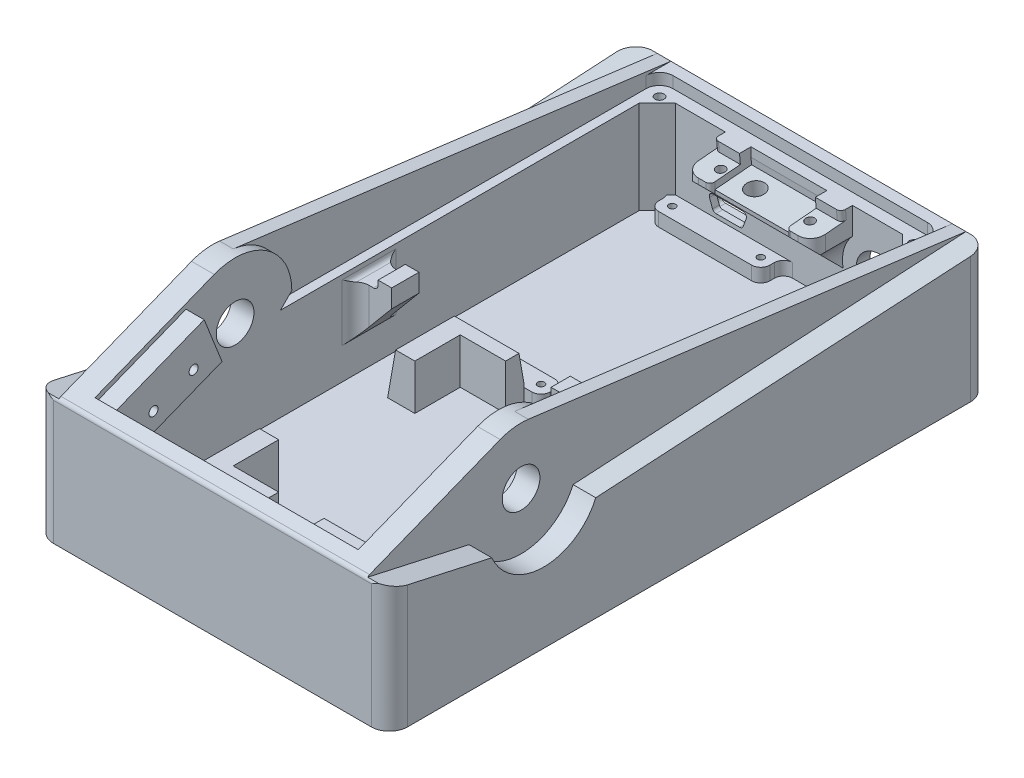
from build123d import *

# Parameters (mm, degrees)
SKETCH1_W            = 78
SKETCH1_H            = 132
BOSS_EXTRUDE1_DEPTH  = 45
SKETCH2_R            = 4.15
CUT_EXTRUDE1_DEPTH   = 65
SKETCH3_W            = 58
SKETCH3_H            = 122
CUT_EXTRUDE2_DEPTH   = 130
CUT_EXTRUDE4_DEPTH   = 5
FILLET1_R            = 4
CUT_EXTRUDE24_DEPTH  = 31
SKETCH37_W           = 62
SKETCH37_H           = 85.5
CUT_EXTRUDE25_DEPTH  = 2.5
CHAMFER6_SIZE        = 2.5
CHAMFER7_SIZE        = 2.5
SKETCH12_W           = 24.5
SKETCH12_H           = 5
SKETCH12_R           = 0.75
BOSS_EXTRUDE2_DEPTH  = 3
FILLET17_R           = 2
CUT_EXTRUDE13_DEPTH  = 3.5
BOSS_EXTRUDE3_DEPTH  = 4
BOSS_EXTRUDE11_DEPTH = 10
SKETCH21_R           = 1
CUT_EXTRUDE16_DEPTH  = 5
BOSS_EXTRUDE9_DEPTH  = 14
BOSS_EXTRUDE10_REACH = 108.054
SKETCH29_W           = 5.65
SKETCH29_H           = 2.524311486
SKETCH30_R           = 1
CUT_EXTRUDE19_DEPTH  = 8
CUT_EXTRUDE14_DEPTH  = 10
SKETCH13_R           = 7.5
CUT_EXTRUDE11_DEPTH  = 2
SKETCH14_R           = 5.2
CUT_EXTRUDE12_DEPTH  = 12
CHAMFER1_SIZE        = 1
FILLET7_R            = 3
FILLET8_R            = 1
SKETCH32_W           = 16.7
SKETCH32_H           = 9.108931259
CUT_EXTRUDE20_DEPTH  = 1.5
SKETCH33_W           = 16.7
SKETCH33_H           = 1
CUT_EXTRUDE21_DEPTH  = 3
FILLET9_R            = 1
CHAMFER2_SIZE        = 2
CHAMFER2_SIZE2       = 2.832352561
CHAMFER3_SIZE        = 4.5
CHAMFER3_SIZE2       = 3.77594834
SKETCH39_R           = 2
CUT_EXTRUDE27_DEPTH  = 9.5
FILLET10_R           = 3
SKETCH40_R           = 8.2
CUT_EXTRUDE28_DEPTH  = 9.5
CHAMFER4_SIZE        = 4
SKETCH41_R           = 1
CUT_EXTRUDE29_DEPTH  = 8
FILLET13_R           = 1
FILLET14_R           = 2
SKETCH53_R           = 3.5
CUT_EXTRUDE34_DEPTH  = 16
CHAMFER12_SIZE       = 2
CHAMFER12_SIZE_2     = 11.342563639
BOSS_EXTRUDE12_DEPTH = 1.5
MIRROR4_START        = -32.5
MIRROR4_DEPTH        = 6
FILLET22_R           = 3
FILLET23_R           = 1
CHAMFER13_SIZE       = 6
CHAMFER13_SIZE2      = 1.057961884


with BuildPart() as part:
    # Sketch1 → Boss-Extrude1 (new body)
    with BuildSketch(Plane(origin=(0, 0, 0), x_dir=(1, 0, 0), z_dir=(0, 1, 0))):
        with Locations((0, 32)):
            Rectangle(SKETCH1_W, SKETCH1_H)
    extrude(amount=BOSS_EXTRUDE1_DEPTH)

    # Sketch2 → Cut-Extrude1 (cut, symmetric)
    with BuildSketch(Plane(origin=(0, 0, 0), x_dir=(0, 0, -1), z_dir=(1, 0, 0))):
        with Locations((0, 28)):
            Circle(SKETCH2_R)
        with BuildLine():
            Line((-4.595588235, 39.624567466), (-34, 28))
            Line((-34, 28), (-34, 45))
            Line((-34, 45), (98, 45))
            Line((98, 45), (98, 28))
            Line((98, 28), (1.594387755, 40.397900132))
            ThreePointArc((1.594387755, 40.397900132), (-1.549616705, 40.403575616), (-4.595588235, 39.624567466))
        make_face()
    extrude(amount=CUT_EXTRUDE1_DEPTH, both=True, mode=Mode.SUBTRACT)

    # Sketch3 → Cut-Extrude2 (cut)
    with BuildSketch(Plane(origin=(0, 5, 0), x_dir=(1, 0, 0), z_dir=(0, 1, 0))):
        with Locations((0, 32)):
            Rectangle(SKETCH3_W, SKETCH3_H)
    extrude(amount=CUT_EXTRUDE2_DEPTH, mode=Mode.SUBTRACT)

    # Sketch4 → Cut-Extrude4 (cut)
    with BuildSketch(Plane(origin=(39, 0, 0), x_dir=(0, 0, -1), z_dir=(1, 0, 0))):
        with BuildLine():
            Line((-34, 28), (-11.456439237, 23))
            ThreePointArc((-11.456439237, 23), (0, 15.5), (11.456439237, 23))
            Line((11.456439237, 23), (98, 28))
            Line((98, 28), (-1.600234273, 40.808733111))
            Line((-1.600234273, 40.808733111), (-34, 28))
        make_face()
    cut_extrude4 = extrude(amount=-CUT_EXTRUDE4_DEPTH, mode=Mode.SUBTRACT)

    # Mirror2: Cut-Extrude4 across plane
    add(cut_extrude4.mirror(Plane(origin=(0, 0, 0), x_dir=(0, 0, 1), z_dir=(1, 0, 0))), mode=Mode.SUBTRACT)

    # Fillet1
    fillet1_edges = [part.edges().sort_by_distance(p)[0] for p in [
        (-39, 14, -98),
        (39, 14, -98),
        (39, 14, 34),
        (-39, 14, 34),
    ]]
    fillet(fillet1_edges, radius=FILLET1_R)

    # Sketch34 → Cut-Extrude24 (cut, symmetric)
    with BuildSketch(Plane(origin=(0, 0, 0), x_dir=(0, 0, -1), z_dir=(1, 0, 0))):
        with BuildLine():
            Line((1.594387755, 40.397900132), (98, 28))
            Line((98, 28), (12.5, 28))
            ThreePointArc((12.5, 28), (9.385623233, 36.255911611), (1.594387755, 40.397900132))
        make_face()
    extrude(amount=CUT_EXTRUDE24_DEPTH, both=True, mode=Mode.SUBTRACT)

    # Sketch37 → Cut-Extrude25 (cut)
    with BuildSketch(Plane(origin=(0, 28, 0), x_dir=(1, 0, 0), z_dir=(0, 1, 0))):
        with Locations((0, 52.75)):
            Rectangle(SKETCH37_W, SKETCH37_H)
    extrude(amount=-CUT_EXTRUDE25_DEPTH, mode=Mode.SUBTRACT)

    # Chamfer6
    chamfer6_edges = [part.edges().sort_by_distance(p)[0] for p in [
        (-30, 28, -10),
    ]]
    chamfer(chamfer6_edges, length=CHAMFER6_SIZE - 0.0001)  # a hair under: the kernel refuses the full size

    # Chamfer7
    chamfer7_edges = [part.edges().sort_by_distance(p)[0] for p in [
        (30, 28, -10),
    ]]
    chamfer(chamfer7_edges, length=CHAMFER7_SIZE - 0.0001)  # a hair under: the kernel refuses the full size

    # Sketch12 → Boss-Extrude2 (add)
    # profile 1 of 2: a face of its own
    with BuildSketch(Plane(origin=(0, 5, 0), x_dir=(1, 0, 0), z_dir=(0, 1, 0))):
        with Locations((-13.45, 90.5)):
            Rectangle(SKETCH12_W, SKETCH12_H)
        with Locations(Location((-3.7, 90.5, 0), (0, 0, 90))):
            Circle(SKETCH12_R, mode=Mode.SUBTRACT)
        with Locations(Location((-23.2, 90.5, 0), (0, 0, 90))):
            Circle(SKETCH12_R, mode=Mode.SUBTRACT)
    # profile 2 of 2: a face of its own
    with BuildSketch(Plane(origin=(0, 5, 0), x_dir=(1, 0, 0), z_dir=(0, 1, 0))):
        with Locations((-13.45, 42.1)):
            Rectangle(SKETCH12_W, SKETCH12_H)
        with Locations(Location((-3.7, 42.1, 0), (0, 0, 90))):
            Circle(SKETCH12_R, mode=Mode.SUBTRACT)
        with Locations(Location((-23.2, 42.1, 0), (0, 0, 90))):
            Circle(SKETCH12_R, mode=Mode.SUBTRACT)
    extrude(amount=BOSS_EXTRUDE2_DEPTH)

    # Fillet17
    fillet17_edges = [part.edges().sort_by_distance(p)[0] for p in [
        (-25.7, 6.5, -93),
        (-25.7, 6.5, -88),
        (-1.2, 6.5, -88),
        (-1.2, 6.5, -93),
        (-25.7, 6.5, -44.6),
        (-25.7, 6.5, -39.6),
        (-1.2, 6.5, -39.6),
        (-1.2, 6.5, -44.6),
    ]]
    fillet(fillet17_edges, radius=FILLET17_R)

    # Sketch15 → Cut-Extrude13 (cut)
    with BuildSketch(Plane(origin=(0, 0, -98), x_dir=(-1, 0, 0), z_dir=(0, 0, -1))):
        with BuildLine():
            Line((7.95, 13.93852886), (18.95, 13.93852886))
            ThreePointArc((18.95, 13.93852886), (19.657106781, 13.645635641), (19.95, 12.93852886))
            Line((19.95, 12.93852886), (19.95, 7.93852886))
            ThreePointArc((19.95, 7.93852886), (19.657106781, 7.231422078), (18.95, 6.93852886))
            Line((18.95, 6.93852886), (7.95, 6.93852886))
            ThreePointArc((7.95, 6.93852886), (7.242893219, 7.231422078), (6.95, 7.93852886))
            Line((6.95, 7.93852886), (6.95, 12.93852886))
            ThreePointArc((6.95, 12.93852886), (7.242893219, 13.645635641), (7.95, 13.93852886))
        make_face()
    extrude(amount=-CUT_EXTRUDE13_DEPTH, mode=Mode.SUBTRACT)

    # Sketch18 → Boss-Extrude3 (add)
    with BuildSketch(Plane(origin=(-29, 0, 0), x_dir=(0, 0, -1), z_dir=(1, 0, 0))):
        Polygon((-10.806851224, 36.093734406), (-29, 28.90136181), (-29, 17.395557367), (-6.873027694, 26.143104655), align=None)
    extrude(amount=BOSS_EXTRUDE3_DEPTH)

    # Sketch57 → Boss-Extrude11 (add)
    with BuildSketch(Plane(origin=(0, 5, 0), x_dir=(1, 0, 0), z_dir=(0, 1, 0))):
        Polygon((5, 35.6), (5, 39.6), (19, 39.6), (19, 25.6), (15, 25.6), (15, 35.6), align=None)
        Polygon((-5, 35.6), (-5, 39.6), (-19, 39.6), (-19, 25.6), (-15, 25.6), (-15, 35.6), align=None)
        Polygon((15, -4.4), (15, -14.4), (5, -14.4), (5, -18.4), (19, -18.4), (19, -4.4), align=None)
        Polygon((-5, -14.4), (-5, -18.4), (-19, -18.4), (-19, -4.4), (-15, -4.4), (-15, -14.4), align=None)
    extrude(amount=BOSS_EXTRUDE11_DEPTH)

    # Sketch21 → Cut-Extrude16 (cut)
    with BuildSketch(Plane(origin=(-25, 0, 0), x_dir=(0, 0, -1), z_dir=(1, 0, 0))):
        with Locations((-13.134022501, 27.700327836)):
            Circle(SKETCH21_R)
        with Locations((-21.968693775, 24.207680777)):
            Circle(SKETCH21_R)
    extrude(amount=-CUT_EXTRUDE16_DEPTH, mode=Mode.SUBTRACT)

    # Sketch28 → Boss-Extrude9 (add, symmetric)
    with BuildSketch(Plane(origin=(0, 0, 0), x_dir=(0, 0, -1), z_dir=(1, 0, 0))):
        Polygon((84.034247717, 21.465752283), (93, 12.5), (93, 23.5), (84.034247717, 22.715598315), align=None)
    extrude(amount=BOSS_EXTRUDE9_DEPTH, both=True)

    # Boss-Extrude10: up to this plane
    boss_extrude10_end = Plane(origin=(0, 25.5, 0), z_dir=(0, -1, 0))
    # Sketch29 → Boss-Extrude10 (add, up to the surface)
    with BuildSketch(Plane(origin=(0, 15.588817922, -2.574775068), x_dir=(1, 0, 0), z_dir=(0, 0.9961946980917453, 0.08715574274766208)), mode=Mode.PRIVATE) as boss_extrude10_sk1:
        with Locations((-11.175, 89.682790344)):
            Rectangle(SKETCH29_W, SKETCH29_H)
    boss_extrude10_tool1 = split(extrude(boss_extrude10_sk1.sketch, amount=BOSS_EXTRUDE10_REACH, mode=Mode.PRIVATE), bisect_by=boss_extrude10_end, keep=Keep.BOTH, mode=Mode.PRIVATE)
    add(boss_extrude10_tool1.solids().sort_by_distance((-11.175, 23.405188, -91.916295))[0])
    # Sketch29 → Boss-Extrude10 (add, up to the surface)
    with BuildSketch(Plane(origin=(0, 15.588817922, -2.574775068), x_dir=(1, 0, 0), z_dir=(0, 0.9961946980917453, 0.08715574274766208)), mode=Mode.PRIVATE) as boss_extrude10_sk2:
        with Locations((11.175, 89.682790344)):
            Rectangle(SKETCH29_W, SKETCH29_H)
    boss_extrude10_tool2 = split(extrude(boss_extrude10_sk2.sketch, amount=BOSS_EXTRUDE10_REACH, mode=Mode.PRIVATE), bisect_by=boss_extrude10_end, keep=Keep.BOTH, mode=Mode.PRIVATE)
    add(boss_extrude10_tool2.solids().sort_by_distance((11.175, 23.405188, -91.916295))[0])

    # Sketch30 → Cut-Extrude19 (cut)
    with BuildSketch(Plane(origin=(0, 15.246850836, 1.333926603), x_dir=(1, 0, 0), z_dir=(0, 0.9961946980917453, 0.08715574274766208))):
        with Locations(Location((9.85, 89.494266877, 0), (0, 0, 270))):
            Circle(SKETCH30_R)
        with Locations(Location((-9.85, 89.494266877, 0), (0, 0, 270))):
            Circle(SKETCH30_R)
    extrude(amount=-CUT_EXTRUDE19_DEPTH, mode=Mode.SUBTRACT)

    # Sketch16 → Cut-Extrude14 (cut)
    with BuildSketch(Plane(origin=(0, 0, -94.5), x_dir=(-1, 0, 0), z_dir=(0, 0, -1))):
        with BuildLine():
            Line((16.825589898, 9.426383885), (17.487680093, 11.245461748))
            ThreePointArc((17.487680093, 11.245461748), (17.391247632, 11.977939011), (16.735925997, 12.319077862))
            Line((16.735925997, 12.319077862), (10.164074003, 12.319077862))
            ThreePointArc((10.164074003, 12.319077862), (9.508752368, 11.977939011), (9.412319907, 11.245461748))
            Line((9.412319907, 11.245461748), (10.074410102, 9.426383885))
            ThreePointArc((10.074410102, 9.426383885), (10.36730305, 9.044678365), (10.826164199, 8.9))
            Line((10.826164199, 8.9), (16.073835801, 8.9))
            ThreePointArc((16.073835801, 8.9), (16.53269695, 9.044678365), (16.825589898, 9.426383885))
        make_face()
    extrude(amount=-CUT_EXTRUDE14_DEPTH, mode=Mode.SUBTRACT)

    # Sketch13 → Cut-Extrude11 (cut)
    with BuildSketch(Plane(origin=(0, 0, -98), x_dir=(-1, 0, 0), z_dir=(0, 0, -1))):
        with Locations((-20, 14)):
            Circle(SKETCH13_R)
    extrude(amount=-CUT_EXTRUDE11_DEPTH, mode=Mode.SUBTRACT)

    # Sketch14 → Cut-Extrude12 (cut)
    with BuildSketch(Plane(origin=(0, 0, -96), x_dir=(-1, 0, 0), z_dir=(0, 0, -1))):
        with Locations((-20, 14)):
            Circle(SKETCH14_R)
    extrude(amount=-CUT_EXTRUDE12_DEPTH, mode=Mode.SUBTRACT)

    # Chamfer1
    chamfer1_edges = [part.edges().sort_by_distance(p)[0] for p in [
        (27.5, 14, -98),
    ]]
    chamfer(chamfer1_edges, length=CHAMFER1_SIZE)

    # Fillet7
    fillet7_edges = [part.edges().sort_by_distance(p)[0] for p in [
        (-14, 22.090675299, -84.034247717),
        (14, 22.090675299, -84.034247717),
    ]]
    fillet(fillet7_edges, radius=FILLET7_R)

    # Fillet8
    fillet8_edges = [part.edges().sort_by_distance(p)[0] for p in [
        (-14, 24.397592002, -90.562494257),
        (14, 24.397592002, -90.562494257),
    ]]
    fillet(fillet8_edges, radius=FILLET8_R)

    # Sketch32 → Cut-Extrude20 (cut)
    with BuildSketch(Plane(origin=(0, 15.246850836, 1.333926603), x_dir=(1, 0, 0), z_dir=(0, 0.9961946980917452, 0.08715574274766207))):
        with Locations((0, 90.139801248)):
            Rectangle(SKETCH32_W, SKETCH32_H)
    extrude(amount=-CUT_EXTRUDE20_DEPTH, mode=Mode.SUBTRACT)

    # Sketch33 → Cut-Extrude21 (cut)
    with BuildSketch(Plane(origin=(0, 13.752558789, 1.203192989), x_dir=(1, 0, 0), z_dir=(0, 0.9961946980917452, 0.08715574274766215))):
        with Locations((0, 86.085335618)):
            Rectangle(SKETCH33_W, SKETCH33_H)
    extrude(amount=-CUT_EXTRUDE21_DEPTH, mode=Mode.SUBTRACT)

    # Fillet9
    fillet9_edges = [part.edges().sort_by_distance(p)[0] for p in [
        (-8.35, 22.090675299, -84.034247717),
        (8.35, 22.090675299, -84.034247717),
    ]]
    fillet(fillet9_edges, radius=FILLET9_R)

    # Chamfer2
    chamfer2_edges = [part.edges().sort_by_distance(p)[0] for p in [
        (0, 29.976670637, 29),
    ]]
    chamfer2_side = [part.faces().sort_by_distance(p)[0] for p in [
        (-31.5, 39.348862811, 5.292984782),
    ]]
    chamfer(chamfer2_edges, length=CHAMFER2_SIZE, length2=CHAMFER2_SIZE2, reference=chamfer2_side[0])

    # Chamfer3
    chamfer3_edges = [part.edges().sort_by_distance(p)[0] for p in [
        (-29, 21.769331011, 17.936513847),
    ]]
    chamfer3_side = [part.faces().sort_by_distance(p)[0] for p in [
        (-29, 16.686661752, -30.686532708),
    ]]
    chamfer(chamfer3_edges, length=CHAMFER3_SIZE, length2=CHAMFER3_SIZE2, reference=chamfer3_side[0])

    # Sketch39 → Cut-Extrude27 (cut)
    with BuildSketch(Plane(origin=(0, 13.752558789, 1.203192989), x_dir=(1, 0, 0), z_dir=(0, 0.9961946980917452, 0.08715574274766215))):
        with Locations(Location((-3.7, 90.852866119, 0), (0, 0, 270))):
            Circle(SKETCH39_R)
    extrude(amount=-CUT_EXTRUDE27_DEPTH, mode=Mode.SUBTRACT)

    # Fillet10
    fillet10_edges = [part.edges().sort_by_distance(p)[0] for p in [
        (-31, 26.75, -95.5),
        (31, 26.75, -95.5),
    ]]
    fillet(fillet10_edges, radius=FILLET10_R)

    # Sketch40 → Cut-Extrude28 (cut)
    with BuildSketch(Plane.XY.offset(-93)):
        with Locations((20, 14)):
            Circle(SKETCH40_R)
    extrude(amount=CUT_EXTRUDE28_DEPTH, mode=Mode.SUBTRACT)

    # Chamfer4
    # the kernel refuses this chamfer: 4 mm, written as the material it adds along each edge
    with BuildSketch(Plane(origin=(29, 5, -93), x_dir=(-1, 0, 0), z_dir=(0, 1, 0))) as chamfer4_piece_1_section:
        Polygon((CHAMFER4_SIZE, 0), (0, CHAMFER4_SIZE), (0, 0), align=None)
    chamfer4_piece_1 = extrude(amount=20.5, mode=Mode.PRIVATE)
    chamfer4_piece_1 = chamfer4_piece_1 - Plane(origin=(20, 14, -93), x_dir=(-1, 0, 0), z_dir=(0, 0, -1)) * Cylinder(5.2, 58, mode=Mode.PRIVATE)
    add(chamfer4_piece_1)
    with BuildSketch(Plane(origin=(-29, 5, -93), x_dir=(0, 0, 1), z_dir=(0, 1, 0))) as chamfer4_piece_2:
        Polygon((CHAMFER4_SIZE, 0), (0, CHAMFER4_SIZE), (0, 0), align=None)
    extrude(amount=20.5)

    # Sketch41 → Cut-Extrude29 (cut)
    with BuildSketch(Plane(origin=(0, 28, 0), x_dir=(1, 0, 0), z_dir=(0, 1, 0))):
        with Locations(Location((28, 92.5, 0), (0, 0, 270))):
            Circle(SKETCH41_R)
        with Locations(Location((-28, 92.5, 0), (0, 0, 270))):
            Circle(SKETCH41_R)
    extrude(amount=-CUT_EXTRUDE29_DEPTH, mode=Mode.SUBTRACT)

    # Fillet13
    # the kernel refuses this fillet: 1 mm, written as the material it takes off along each edge
    with BuildSketch(Plane(origin=(38.079848195, 28, 34), x_dir=(0, 0.3676470588235281, -0.9299653972801403), z_dir=(-1, 0, 0))) as fillet13_piece_1:
        with BuildLine():
            CenterArc((FILLET13_R * 0.679974699087, FILLET13_R), FILLET13_R, 201.570578302, 68.429421698)
            Line((-FILLET13_R * 0.249990698194, FILLET13_R * 0.632352941176), (-FILLET13_R * 0.268590006139, FILLET13_R * 0.625))
            Line((-FILLET13_R * 0.268590006139, FILLET13_R * 0.625), (-FILLET13_R * 0.0135994939817, -FILLET13_R * 0.02))
            Line((-FILLET13_R * 0.0135994939817, -FILLET13_R * 0.02), (FILLET13_R * 0.679974699087, -FILLET13_R * 0.02))
            Line((FILLET13_R * 0.679974699087, -FILLET13_R * 0.02), (FILLET13_R * 0.679974699087, 0))
        make_face()
    extrude(amount=76.159696389, mode=Mode.SUBTRACT)

    # Fillet14
    fillet14_edges = [part.edges().sort_by_distance(p)[0] for p in [
        (29, 16.072159038, 29),
        (-29, 8.778333824, 29),
    ]]
    fillet(fillet14_edges, radius=FILLET14_R)

    # Sketch53 → Cut-Extrude34 (cut)
    with BuildSketch(Plane(origin=(0, 2.567958163, -39.6), x_dir=(-1, 0, 0), z_dir=(0, 0, -1))):
        with Locations((-13, 6.432041837)):
            Circle(SKETCH53_R)
    extrude(amount=-CUT_EXTRUDE34_DEPTH, mode=Mode.SUBTRACT)

    # Chamfer12
    # the kernel refuses this chamfer: 11.342563639, 2 mm, written as the material it adds along each edge
    with BuildSketch(Plane(origin=(24.474091667, 5, 18.4), x_dir=(0, 0, 1), z_dir=(-1, 0, 0))) as chamfer12_piece_1_section:
        Polygon((CHAMFER12_SIZE, 0), (0, CHAMFER12_SIZE_2), (0, 0), align=None)
    chamfer12_piece_1 = extrude(amount=72.948183335, mode=Mode.PRIVATE)
    chamfer12_piece_1 = split(chamfer12_piece_1, bisect_by=Plane(origin=(19, 5, 18.4), z_dir=(-1, 0, 0)), keep=Keep.TOP, mode=Mode.PRIVATE)
    chamfer12_piece_1 = split(chamfer12_piece_1, bisect_by=Plane(origin=(5, 5, 18.4), z_dir=(1, 0, 0)), keep=Keep.TOP, mode=Mode.PRIVATE)
    chamfer12_piece_1 = split(chamfer12_piece_1, bisect_by=Plane(origin=(24.474091667, 15, 18.4), z_dir=(0, -1, 0)), keep=Keep.TOP, mode=Mode.PRIVATE)
    add(chamfer12_piece_1)
    with BuildSketch(Plane(origin=(-5, 5, 18.4), x_dir=(0, 0, 1), z_dir=(-1, 0, 0))) as chamfer12_piece_2_section:
        Polygon((CHAMFER12_SIZE, 0), (0, CHAMFER12_SIZE_2), (0, 0), align=None)
    chamfer12_piece_2 = extrude(amount=43.474091667, mode=Mode.PRIVATE)
    chamfer12_piece_2 = split(chamfer12_piece_2, bisect_by=Plane(origin=(-5, 15, 18.4), z_dir=(0, -1, 0)), keep=Keep.TOP, mode=Mode.PRIVATE)
    chamfer12_piece_2 = split(chamfer12_piece_2, bisect_by=Plane(origin=(-20.517540966, 7.736161147, 18.4), z_dir=(0.9848077530122086, -0.17364817766692728, 0)), keep=Keep.TOP, mode=Mode.PRIVATE)
    add(chamfer12_piece_2)
    with BuildSketch(Plane(origin=(-19, 5, 47.874091667), x_dir=(-1, 0, 0), z_dir=(0, 0, -1))) as chamfer12_piece_3_section:
        Polygon((CHAMFER12_SIZE, 0), (0, CHAMFER12_SIZE_2), (0, 0), align=None)
    chamfer12_piece_3 = extrude(amount=43.474091667, mode=Mode.PRIVATE)
    chamfer12_piece_3 = split(chamfer12_piece_3, bisect_by=Plane(origin=(-19, 15, 47.874091667), z_dir=(0, -1, 0)), keep=Keep.TOP, mode=Mode.PRIVATE)
    chamfer12_piece_3 = split(chamfer12_piece_3, bisect_by=Plane(origin=(-19, 0.301653615, 21.228445232), z_dir=(0, -0.1736481776669276, -0.9848077530122086)), keep=Keep.TOP, mode=Mode.PRIVATE)
    add(chamfer12_piece_3)
    with BuildSketch(Plane(origin=(-19, 5, -39.6), x_dir=(-1, 0, 0), z_dir=(0, 0, 1))) as chamfer12_piece_4_section:
        Polygon((CHAMFER12_SIZE, 0), (0, -CHAMFER12_SIZE_2), (0, 0), align=None)
    chamfer12_piece_4 = extrude(amount=14, mode=Mode.PRIVATE)
    chamfer12_piece_4 = split(chamfer12_piece_4, bisect_by=Plane(origin=(-19, 15, -39.6), z_dir=(0, -1, 0)), keep=Keep.TOP, mode=Mode.PRIVATE)
    add(chamfer12_piece_4)
    with BuildSketch(Plane(origin=(-24.474091667, 5, 18.4), x_dir=(0, 0, 1), z_dir=(1, 0, 0))) as chamfer12_piece_5_section:
        Polygon((CHAMFER12_SIZE, 0), (0, -CHAMFER12_SIZE_2), (0, 0), align=None)
    chamfer12_piece_5 = extrude(amount=72.948183335, mode=Mode.PRIVATE)
    chamfer12_piece_5 = split(chamfer12_piece_5, bisect_by=Plane(origin=(-5, 5, 18.4), z_dir=(-1, 0, 0)), keep=Keep.TOP, mode=Mode.PRIVATE)
    chamfer12_piece_5 = split(chamfer12_piece_5, bisect_by=Plane(origin=(-19, 5, 18.4), z_dir=(1, 0, 0)), keep=Keep.TOP, mode=Mode.PRIVATE)
    chamfer12_piece_5 = split(chamfer12_piece_5, bisect_by=Plane(origin=(-24.474091667, 15, 18.4), z_dir=(0, -1, 0)), keep=Keep.TOP, mode=Mode.PRIVATE)
    add(chamfer12_piece_5)
    with BuildSketch(Plane(origin=(5, 5, 18.4), x_dir=(0, 0, 1), z_dir=(1, 0, 0))) as chamfer12_piece_6_section:
        Polygon((CHAMFER12_SIZE, 0), (0, -CHAMFER12_SIZE_2), (0, 0), align=None)
    chamfer12_piece_6 = extrude(amount=43.474091667, mode=Mode.PRIVATE)
    chamfer12_piece_6 = split(chamfer12_piece_6, bisect_by=Plane(origin=(5, 15, 18.4), z_dir=(0, -1, 0)), keep=Keep.TOP, mode=Mode.PRIVATE)
    chamfer12_piece_6 = split(chamfer12_piece_6, bisect_by=Plane(origin=(20.517540966, 7.736161147, 18.4), z_dir=(-0.9848077530122086, -0.17364817766692728, 0)), keep=Keep.TOP, mode=Mode.PRIVATE)
    add(chamfer12_piece_6)
    with BuildSketch(Plane(origin=(19, 5, 47.874091667), x_dir=(1, 0, 0), z_dir=(0, 0, -1))) as chamfer12_piece_7_section:
        Polygon((CHAMFER12_SIZE, 0), (0, -CHAMFER12_SIZE_2), (0, 0), align=None)
    chamfer12_piece_7 = extrude(amount=43.474091667, mode=Mode.PRIVATE)
    chamfer12_piece_7 = split(chamfer12_piece_7, bisect_by=Plane(origin=(19, 15, 47.874091667), z_dir=(0, -1, 0)), keep=Keep.TOP, mode=Mode.PRIVATE)
    chamfer12_piece_7 = split(chamfer12_piece_7, bisect_by=Plane(origin=(19, 0.301653615, 21.228445232), z_dir=(0, -0.17364817766692728, -0.9848077530122086)), keep=Keep.TOP, mode=Mode.PRIVATE)
    add(chamfer12_piece_7)
    with BuildSketch(Plane(origin=(5, 5, -39.6), x_dir=(0, 0, -1), z_dir=(1, 0, 0))) as chamfer12_piece_8_section:
        Polygon((CHAMFER12_SIZE, 0), (0, CHAMFER12_SIZE_2), (0, 0), align=None)
    chamfer12_piece_8 = extrude(amount=43.474091667, mode=Mode.PRIVATE)
    chamfer12_piece_8 = split(chamfer12_piece_8, bisect_by=Plane(origin=(5, 15, -39.6), z_dir=(0, -1, 0)), keep=Keep.TOP, mode=Mode.PRIVATE)
    chamfer12_piece_8 = chamfer12_piece_8 - Plane(origin=(13, 9, -39.6), x_dir=(-1, 0, 0), z_dir=(0, 0, -1)) * Cylinder(3.5, 133, mode=Mode.PRIVATE)
    chamfer12_piece_8 = split(chamfer12_piece_8, bisect_by=Plane(origin=(20.517540966, 7.736161147, -39.6), z_dir=(-0.9848077530122086, -0.17364817766692728, 0)), keep=Keep.TOP, mode=Mode.PRIVATE)
    add(chamfer12_piece_8)
    with BuildSketch(Plane(origin=(19, 5, -69.074091667), x_dir=(1, 0, 0), z_dir=(0, 0, 1))) as chamfer12_piece_9_section:
        Polygon((CHAMFER12_SIZE, 0), (0, CHAMFER12_SIZE_2), (0, 0), align=None)
    chamfer12_piece_9 = extrude(amount=43.474091667, mode=Mode.PRIVATE)
    chamfer12_piece_9 = split(chamfer12_piece_9, bisect_by=Plane(origin=(19, 15, -69.074091667), z_dir=(0, -1, 0)), keep=Keep.TOP, mode=Mode.PRIVATE)
    chamfer12_piece_9 = split(chamfer12_piece_9, bisect_by=Plane(origin=(19, 0.301653615, -42.428445232), z_dir=(0, -0.17364817766692728, 0.9848077530122086)), keep=Keep.TOP, mode=Mode.PRIVATE)
    add(chamfer12_piece_9)

    # Sketch58 → Boss-Extrude12 (add, symmetric)
    with BuildSketch(Plane.XY.offset(-28)):
        Polygon((-29, 11.965971259), (-29, 23.5), (-24, 23.5), (-24, 25.5), (-21, 25.5), (-21, 21.5), align=None)
    extrude(amount=BOSS_EXTRUDE12_DEPTH, both=True)

    # Mirror4: read off the stored shape, not the designer's step
    # Mirror4 outline → Mirror4 (add)
    with BuildSketch(Plane.XY.offset(MIRROR4_START)):
        Polygon((24, 25.5), (21, 25.5), (21, 21.5), (29, 11.965971259), (29, 23.5), (24, 23.5), align=None)
        Polygon((-21, 25.5), (-24, 25.5), (-24, 23.5), (-29, 23.5), (-29, 11.965971259), (-21, 21.5), align=None)
    extrude(amount=MIRROR4_DEPTH)

    # Fillet22
    fillet22_edges = [part.edges().sort_by_distance(p)[0] for p in [
        (-29, 17.73298563, -26.5),
        (-29, 17.732985629, -32.5),
        (29, 17.732985629, -26.5),
        (29, 17.732985629, -32.5),
    ]]
    fillet(fillet22_edges, radius=FILLET22_R)

    # Fillet23
    fillet23_edges = [part.edges().sort_by_distance(p)[0] for p in [
        (-24, 23.5, -29.5),
        (-29, 23.5, -29.5),
        (29, 23.5, -29.5),
        (24, 23.5, -29.5),
    ]]
    fillet(fillet23_edges, radius=FILLET23_R)

    # Chamfer13
    chamfer13_edges = [part.edges().sort_by_distance(p)[0] for p in [
        (-12.118365096, 15, -39.6),
    ]]
    chamfer13_side = [part.faces().sort_by_distance(p)[0] for p in [
        (-12.431210802, 11.451527675, -39.6),
    ]]
    chamfer(chamfer13_edges, length=CHAMFER13_SIZE, length2=CHAMFER13_SIZE2, reference=chamfer13_side[0])


solid = part.part
